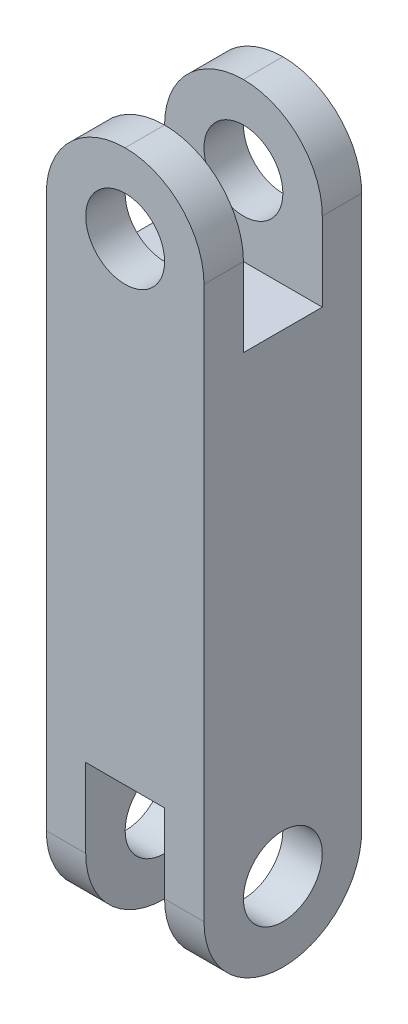
from build123d import *

# Parameters (mm, degrees)
SKETCH2_W               = 101.6
SKETCH2_H               = 101.6
BOSS_EXTRUDE1_DEPTH     = 457.2
CUT_EXTRUDE1_DEPTH      = 463.810025821
CUT_EXTRUDE1_DEPTH_BACK = 463.810025821
SKETCH3_R               = 25.4
SKETCH3_W               = 50.8
SKETCH3_H               = 101.6
FILLET1_R               = 50.8
CUT_EXTRUDE2_DEPTH      = 472.099819571
CUT_EXTRUDE2_DEPTH_BACK = 472.099819571
SKETCH4_R               = 25.4
SKETCH4_W               = 50.8
SKETCH4_H               = 101.6


with BuildPart() as part:
    # Sketch2 → Boss-Extrude1 (new body)
    with BuildSketch(Plane(origin=(0, 0, 0), x_dir=(1, 0, 0), z_dir=(0, 1, 0))):
        Rectangle(SKETCH2_W, SKETCH2_H)
    extrude(amount=BOSS_EXTRUDE1_DEPTH)

    # Sketch3 → Cut-Extrude1 (cut, two sides: drawn at the far end of the back side and taken through both)
    with BuildSketch(Plane.XY.offset(-CUT_EXTRUDE1_DEPTH_BACK)):
        with Locations((0, 406.4)):
            Circle(SKETCH3_R)
        with Locations((0, 50.8)):
            Rectangle(SKETCH3_W, SKETCH3_H)
    extrude(amount=CUT_EXTRUDE1_DEPTH + CUT_EXTRUDE1_DEPTH_BACK, mode=Mode.SUBTRACT)

    # Fillet1
    fillet1_edges = [part.edges().sort_by_distance(p)[0] for p in [
        (-38.1, 0, -50.8),
        (-38.1, 0, 50.8),
        (38.1, 0, -50.8),
        (38.1, 0, 50.8),
        (-50.8, 457.2, 0),
        (50.8, 457.2, 0),
    ]]
    fillet(fillet1_edges, radius=FILLET1_R - 0.0001)  # a hair under: the kernel refuses the full size

    # Sketch4 → Cut-Extrude2 (cut, two sides: drawn at the far end of the back side and taken through both)
    with BuildSketch(Plane(origin=(50.8, 0, 0), x_dir=(0, 0, -1), z_dir=(1, 0, 0)).offset(-CUT_EXTRUDE2_DEPTH_BACK)):
        with Locations((0, 50.8)):
            Circle(SKETCH4_R)
        with Locations((0, 406.4)):
            Rectangle(SKETCH4_W, SKETCH4_H)
    extrude(amount=CUT_EXTRUDE2_DEPTH + CUT_EXTRUDE2_DEPTH_BACK, mode=Mode.SUBTRACT)


solid = part.part
